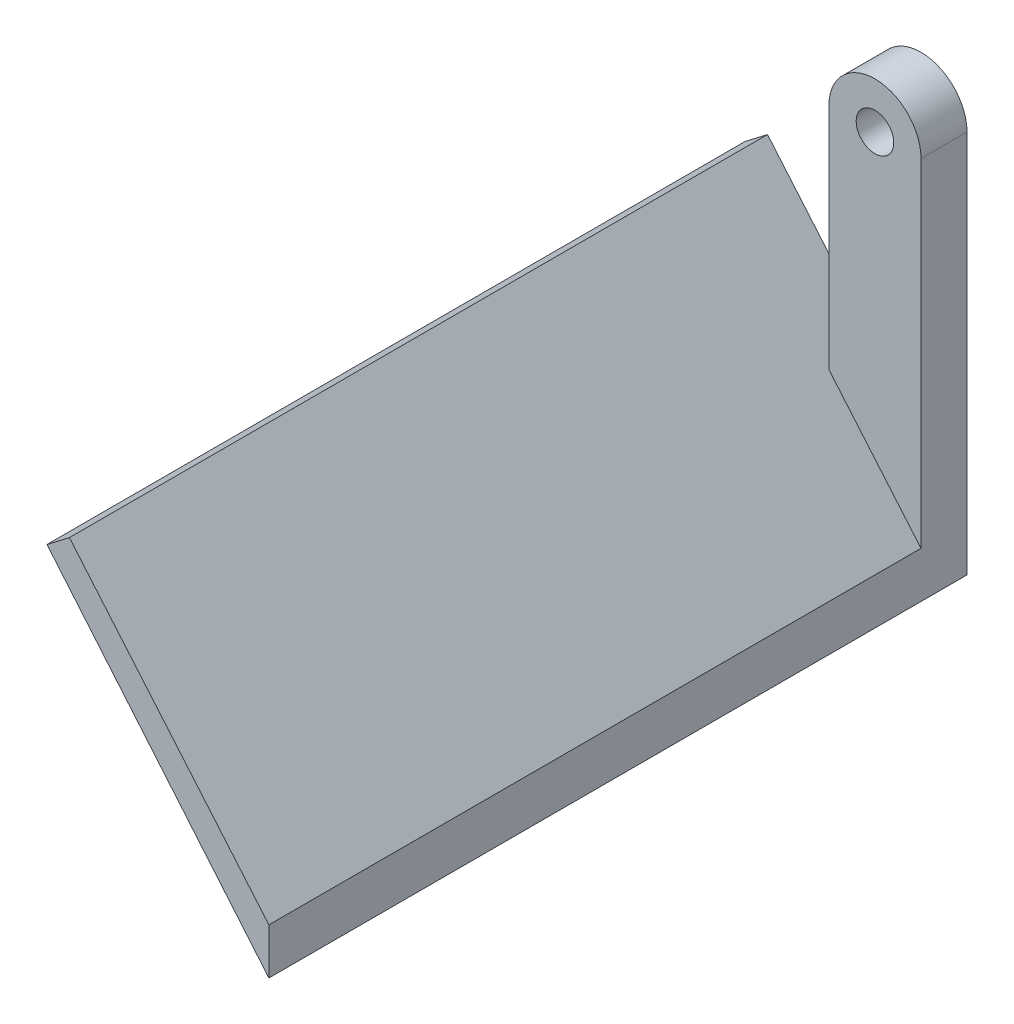
from build123d import *

# Parameters (mm, degrees)
CROQUIS2_R              = 2.45
SALIENTE_EXTRUIR1_DEPTH = 6
SALIENTE_EXTRUIR2_DEPTH = 91


with BuildPart() as part:
    # Croquis2 → Saliente-Extruir1 (new body)
    with BuildSketch(Plane(origin=(0, 0, -1133.883018812), x_dir=(-1, 0, 0), z_dir=(0, 0, -1))):
        with BuildLine():
            Line((-11.1, 0), (-11.1, -50))
            Line((-11.1, -50), (0.9, -50))
            Line((0.9, -50), (0.9, 0))
            ThreePointArc((0.9, 0), (-5.1, 6), (-11.1, 0))
        make_face()
        with Locations((-5.1, 0)):
            Circle(CROQUIS2_R, mode=Mode.SUBTRACT)
    extrude(amount=SALIENTE_EXTRUIR1_DEPTH)

    # Croquis3 → Saliente-Extruir2 (add)
    with BuildSketch(Plane(origin=(0, 0, -1139.883018812), x_dir=(-1, 0, 0), z_dir=(0, 0, -1))):
        Polygon((-11.1, -50), (17.825442436, -15.52800006), (14.903598687, -13.287396749), (-11.1, -44), align=None)
    extrude(amount=-SALIENTE_EXTRUIR2_DEPTH)


solid = part.part
